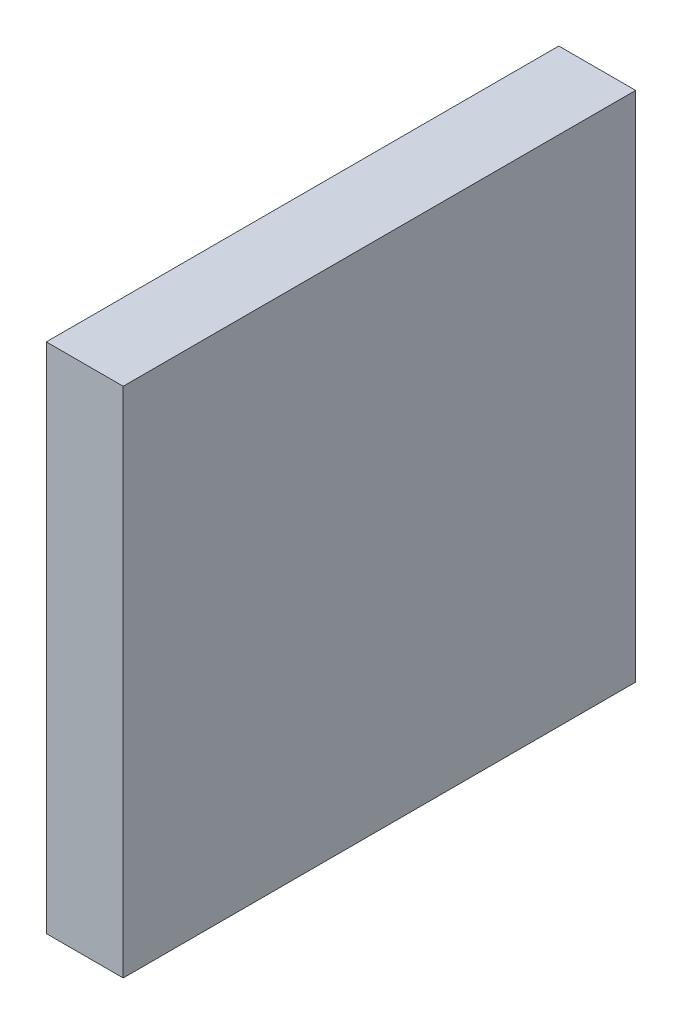
from build123d import *

# Parameters (mm, degrees)
SKETCH2_W           = 100
SKETCH2_H           = 100
BOSS_EXTRUDE1_DEPTH = 15


with BuildPart() as part:
    # Sketch2 → Boss-Extrude1 (new body)
    with BuildSketch(Plane(origin=(0, 0, 0), x_dir=(0, 0, -1), z_dir=(1, 0, 0))):
        Rectangle(SKETCH2_W, SKETCH2_H)
    extrude(amount=BOSS_EXTRUDE1_DEPTH)


solid = part.part
